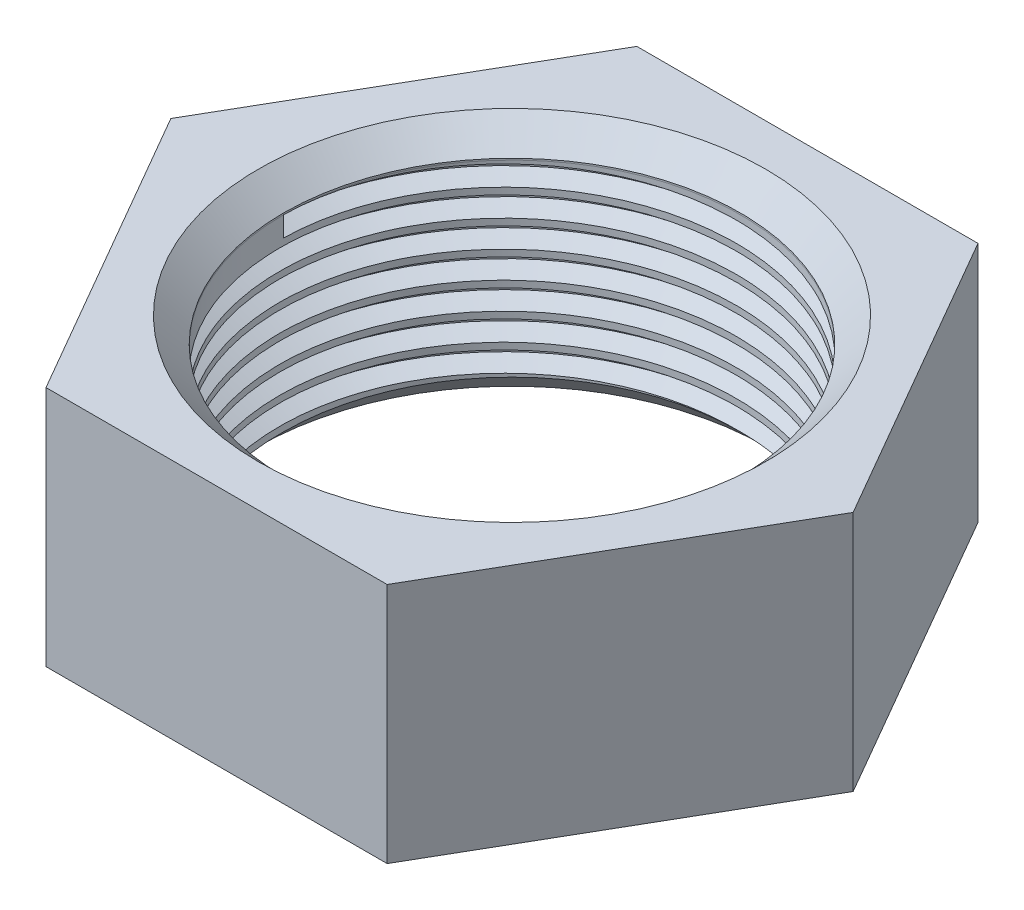
from build123d import *

# Parameters (mm, degrees)
BOSS_EXTRUDE1_DEPTH = 9
THREAD1_PITCH       = 1
CHAMFER1_SIZE       = 1


with BuildPart() as part:
    # Sketch2 → Boss-Extrude1 (new body)
    with BuildSketch(Plane(origin=(0, 0, 0), x_dir=(1, 0, 0), z_dir=(0, 1, 0))):
        Polygon((12.701705922, 0), (6.350852961, 11), (-6.350852961, 11), (-12.701705922, 0), (-6.350852961, -11), (6.350852961, -11), align=None)
    extrude(amount=BOSS_EXTRUDE1_DEPTH)

    # Sketch3 → Cut-Revolve1 (revolve, cut)
    with BuildSketch(Plane(origin=(0, 0, 0), x_dir=(0, 0, -1), z_dir=(1, 0, 0))):
        with BuildLine():
            Line((8.5, 8), (8.5, 0))
            Line((8.5, 0), (0, 0))
            Line((0, 0), (0, 16.5))
            ThreePointArc((0, 16.5), (6.01040764, 14.01040764), (8.5, 8))
        make_face()
    revolve(axis=Axis((0, 0, 0), (0, 1, 0)), mode=Mode.SUBTRACT)

    # Thread1: arcs per turn and ends read off the stored shape
    # Thread1: the profile of Thread Profile4 profile screwed along a right-hand helix through 7 turns, 8 arcs to a turn; built about Z, then put on its axis
    thread1_z = Axis((0, 0, 0), (0, 0, 1))
    thread1_corners = [(8.4997, 0, -0.000173205), (9.041265875, 0, 0.312499999), (9.041265875, 0, 0.437499999), (8.4997, 0, 0.750173202)]
    with BuildLine(mode=Mode.PRIVATE) as thread1_profile:
        Line(thread1_corners[0], thread1_corners[1])
        Line(thread1_corners[1], thread1_corners[2])
        Line(thread1_corners[2], thread1_corners[3])
        Line(thread1_corners[3], thread1_corners[0])
    thread1_cap = Face(thread1_profile.wire())
    thread1_turn_angles = [0, 22.5, 45, 67.5, 90, 112.5, 135, 157.5, 180, 202.5, 225, 247.5, 270, 292.5, 315, 337.5, 360]
    thread1_turn_weights = [1, 0.9238795325112867, 1, 0.9238795325112867, 1, 0.9238795325112867, 1, 0.9238795325112867, 1, 0.9238795325112867, 1, 0.9238795325112867, 1, 0.9238795325112867, 1, 0.9238795325112867, 1]
    thread1_turn_rails = [Edge.make_bspline([Vector(p[0], p[1], 0).rotate(thread1_z, thread1_turn_angles[k]) / thread1_turn_weights[k] + Vector(0, 0, p[2] + THREAD1_PITCH * thread1_turn_angles[k] / 360) for k in range(17)], [0, 0, 0, 1, 1, 2, 2, 3, 3, 4, 4, 5, 5, 6, 6, 7, 7, 8, 8, 8], 2, thread1_turn_weights) for p in thread1_corners]
    thread1_turn_sides = [Face.make_surface_from_curves(thread1_turn_rails[p[0]], thread1_turn_rails[p[1]]) for p in [(0, 1), (1, 2), (2, 3), (3, 0)]]
    thread1 = Plane(origin=(0, 8, 0), x_dir=(-1, 0, 0), z_dir=(0, -1, 0)) * Solid(Shell([*[p.moved(Location((0, 0, THREAD1_PITCH * i))) for i in range(7) for p in thread1_turn_sides], thread1_cap, thread1_cap.rotate(thread1_z, 2520).moved(Location((0, 0, THREAD1_PITCH * 2520 / 360)))]))
    add(thread1, mode=Mode.SUBTRACT)

    # Chamfer1
    # the kernel refuses this chamfer: 1, 0.900331072 mm, written as the material it takes off along each edge
    with BuildSketch(Plane(origin=(0, 9, 0), x_dir=(0, 0, -1), z_dir=(-1, 0, 0))) as chamfer1_piece_1:
        with BuildLine():
            Line((8.440971508 + CHAMFER1_SIZE, 0), (8.499796446, 0.941175062))
            ThreePointArc((8.499796446, 0.941175062), (8.4842639, 0.483022178), (8.440971508, 0))
            Line((8.440971508, 0), (8.440971508 + CHAMFER1_SIZE, 0))
        make_face()
    revolve(axis=Axis((0, 9, 0), (0, -1, 0)), mode=Mode.SUBTRACT)
    with BuildSketch(Plane(origin=(0, 0, 0), x_dir=(0, 0, -1), z_dir=(1, 0, 0))) as chamfer1_piece_2:
        Polygon((8.5 + CHAMFER1_SIZE, 0), (8.5, CHAMFER1_SIZE), (8.5, 0), align=None)
    revolve(axis=Axis((0, 0, 0), (0, 1, 0)), mode=Mode.SUBTRACT)


solid = part.part
